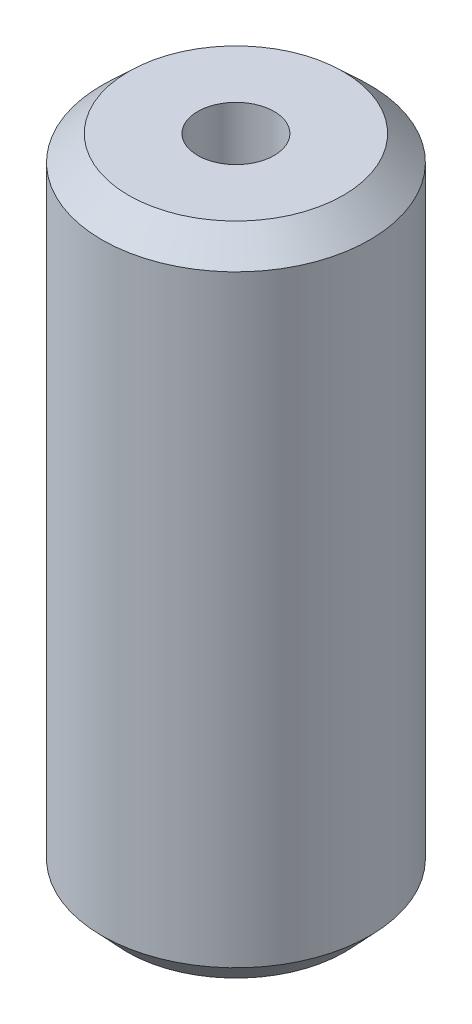
from build123d import *
from OCP.BRepFilletAPI import BRepFilletAPI_MakeChamfer

# Parameters (mm, degrees)
SKETCH1_R           = 22.5
BOSS_EXTRUDE1_DEPTH = 109.928357076
SKETCH2_R           = 6.413752125
CUT_EXTRUDE1_DEPTH  = 115.44100528
CHAMFER1_SIZE       = 4.222788862
CHAMFER1_SIZE2      = 4.482571126


with BuildPart() as part:
    # Sketch1 → Boss-Extrude1 (new body)
    with BuildSketch(Plane(origin=(0, 0, 0), x_dir=(1, 0, 0), z_dir=(0, 1, 0))):
        Circle(SKETCH1_R)
    extrude(amount=BOSS_EXTRUDE1_DEPTH)

    # Sketch2 → Cut-Extrude1 (cut, through all)
    with BuildSketch(Plane(origin=(0, 0, 0), x_dir=(1, 0, 0), z_dir=(0, 1, 0))):
        Circle(SKETCH2_R)
    extrude(amount=CUT_EXTRUDE1_DEPTH, mode=Mode.SUBTRACT)

    # Chamfer1: one chamfer whose edges measure the first distance from different faces: ONE call of the kernel's chamfer builder (chamfer() names one face for all edges)
    chamfer1_edges_1 = [part.edges().sort_by_distance(p)[0] for p in [
        (-22.5, 109.928357076, 0),
    ]]
    chamfer1_side_1 = [part.faces().sort_by_distance(p)[0] for p in [
        (-22.5, 54.964178538, 0),
    ]]
    chamfer1_edges_2 = [part.edges().sort_by_distance(p)[0] for p in [
        (-22.5, 0, 0),
    ]]
    chamfer1_side_2 = [part.faces().sort_by_distance(p)[0] for p in [
        (-21.863603897, 0, 0),
    ]]
    chamfer1 = BRepFilletAPI_MakeChamfer(part.part.solid().wrapped)
    for e in chamfer1_edges_1:
        chamfer1.Add(CHAMFER1_SIZE, CHAMFER1_SIZE2, e.wrapped, chamfer1_side_1[0].wrapped)  # the first distance lies on this face
    for e in chamfer1_edges_2:
        chamfer1.Add(CHAMFER1_SIZE, CHAMFER1_SIZE2, e.wrapped, chamfer1_side_2[0].wrapped)  # the first distance lies on this face
    add(Compound.cast(chamfer1.Shape()), mode=Mode.REPLACE)


solid = part.part
